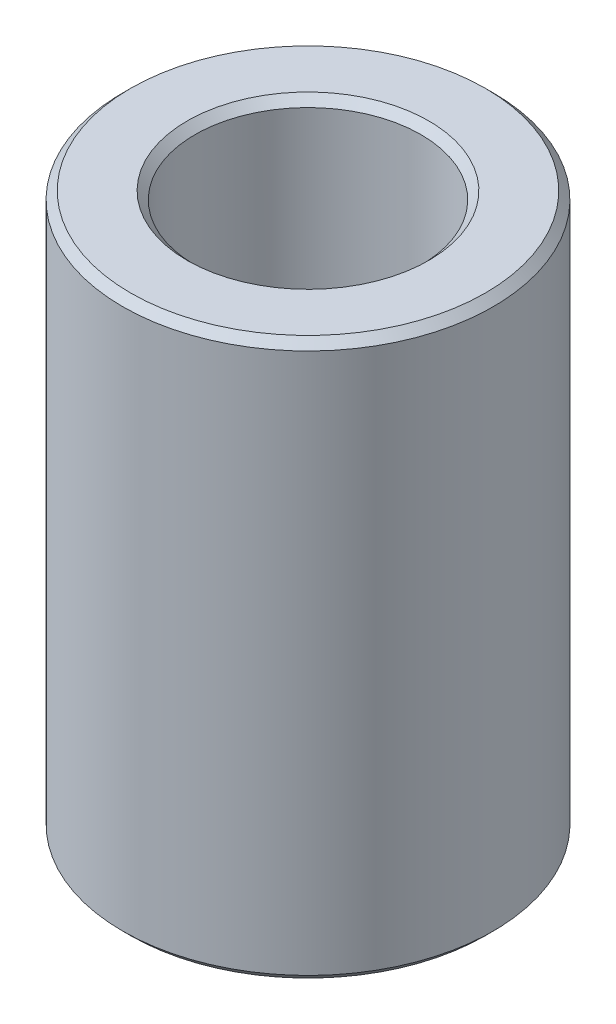
from build123d import *

# Parameters (mm, degrees)
SKETCH1_R           = 42.5
BOSS_EXTRUDE1_DEPTH = 127.702674319
SKETCH2_R           = 25.918400938
CUT_EXTRUDE1_DEPTH  = 142.139905868
CHAMFER1_SIZE       = 1.811723703


with BuildPart() as part:
    # Sketch1 → Boss-Extrude1 (new body)
    with BuildSketch(Plane(origin=(0, 0, 0), x_dir=(1, 0, 0), z_dir=(0, 1, 0))):
        Circle(SKETCH1_R)
    extrude(amount=BOSS_EXTRUDE1_DEPTH)

    # Sketch2 → Cut-Extrude1 (cut, through all)
    with BuildSketch(Plane(origin=(0, 0, 0), x_dir=(1, 0, 0), z_dir=(0, 1, 0))):
        Circle(SKETCH2_R)
    extrude(amount=CUT_EXTRUDE1_DEPTH, mode=Mode.SUBTRACT)

    # Chamfer1
    chamfer1_edges = [part.edges().sort_by_distance(p)[0] for p in [
        (-25.918400938, 127.702674319, 0),
        (-25.918400938, 0, 0),
        (-42.5, 0, 0),
        (-42.5, 127.702674319, 0),
    ]]
    chamfer(chamfer1_edges, length=CHAMFER1_SIZE)


solid = part.part
